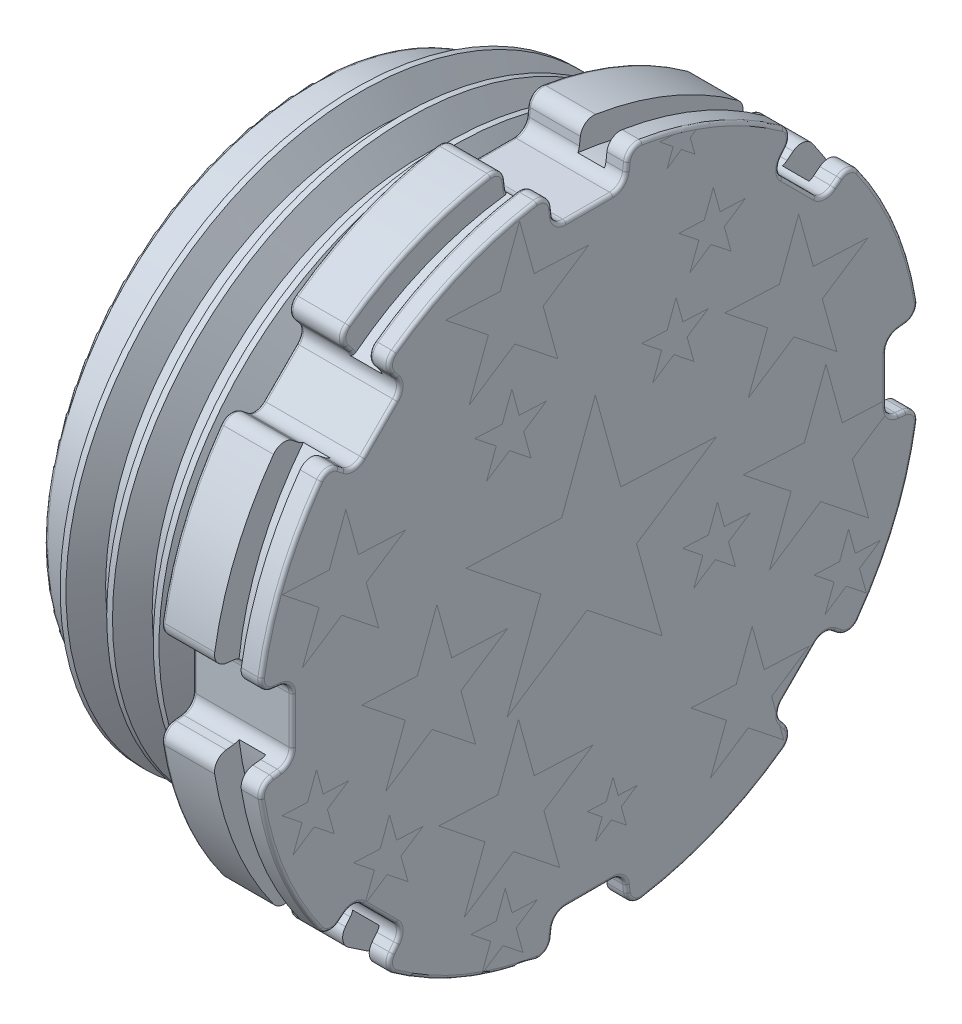
from build123d import *

# Parameters (mm, degrees)
CUT_EXTRUDE1_DEPTH       = 10
FILLET1_R                = 0.2
CIRPATTERN1_COUNT        = 8
FILLET1_OF_CIRPATTERN1_R = 0.2
FILLET2_R                = 0.05
SKETCH3_R                = 3.299808774
CUT_EXTRUDE2_DEPTH       = 3.9
FILLET3_R                = 0.05
THREAD1_PITCH            = 0.7


with BuildPart() as part:
    # Sketch1 → Revolve1 (revolve)
    with BuildSketch(Plane(origin=(0, 0, 0), x_dir=(1, 0, 0), z_dir=(0, 1, 0))):
        Polygon((0, 4), (2.7, 4), (2.7, 5), (3.5, 5), (3.5, 4.6), (3.9, 4.6), (3.9, 5), (4.2, 5), (4.2, 0), (0, 0), align=None)
    revolve(axis=Axis((4.2, 0, 0), (-1, 0, 0)))

    # Sketch2 → Cut-Extrude1 (cut)
    with BuildSketch(Plane(origin=(4.2, 0, 0), x_dir=(0, 0, -1), z_dir=(1, 0, 0))):
        with BuildLine():
            Line((-0.587686987, 4.965342285), (-0.549807555, 4.645300577))
            ThreePointArc((-0.549807555, 4.645300577), (-0.484044351, 4.519306391), (-0.351193864, 4.468808056))
            Line((-0.351193864, 4.468808056), (0.351193864, 4.468808056))
            ThreePointArc((0.351193864, 4.468808056), (0.484044351, 4.519306391), (0.549807555, 4.645300577))
            Line((0.549807555, 4.645300577), (0.587686987, 4.965342285))
            Line((0.587686987, 4.965342285), (1.311604188, 5.951762014))
            Line((1.311604188, 5.951762014), (-0.361272215, 5.978082862))
            Line((-0.361272215, 5.978082862), (-0.587686987, 4.965342285))
        make_face()
    cut_extrude1 = extrude(amount=-CUT_EXTRUDE1_DEPTH, mode=Mode.SUBTRACT)

    # Fillet1
    fillet1_edges = [part.edges().sort_by_distance(p)[0] for p in [
        (3.1, 4.965342285, -0.587686987),
        (4.05, 4.965342285, -0.587686987),
        (3.1, 4.965342285, 0.587686987),
        (4.05, 4.965342285, 0.587686987),
    ]]
    fillet(fillet1_edges, radius=FILLET1_R)

    # CirPattern1: Cut-Extrude1 ×8 about axis
    cirpattern1_axis = Axis((0, 0, 0), (1, 0, 0))
    for i in range(1, CIRPATTERN1_COUNT):
        add(cut_extrude1.rotate(cirpattern1_axis, i * 360 / CIRPATTERN1_COUNT), mode=Mode.SUBTRACT)

    # Fillet1 of CirPattern1
    fillet1_of_cirpattern1_edges = [part.edges().sort_by_distance(p)[0] for p in [
        (3.1, 3.926584654, 3.095469747),
        (4.05, 3.926584654, 3.095469747),
        (3.1, 3.095469747, 3.926584654),
        (4.05, 3.095469747, 3.926584654),
        (3.1, 0.587686987, 4.965342285),
        (4.05, 0.587686987, 4.965342285),
        (3.1, -0.587686987, 4.965342285),
        (4.05, -0.587686987, 4.965342285),
        (3.1, -3.095469747, 3.926584654),
        (4.05, -3.095469747, 3.926584654),
        (3.1, -3.926584654, 3.095469747),
        (4.05, -3.926584654, 3.095469747),
        (3.1, -4.965342285, 0.587686987),
        (4.05, -4.965342285, 0.587686987),
        (3.1, -4.965342285, -0.587686987),
        (4.05, -4.965342285, -0.587686987),
        (3.1, -3.926584654, -3.095469747),
        (4.05, -3.926584654, -3.095469747),
        (3.1, -3.095469747, -3.926584654),
        (4.05, -3.095469747, -3.926584654),
        (3.1, -0.587686987, -4.965342285),
        (4.05, -0.587686987, -4.965342285),
        (3.1, 0.587686987, -4.965342285),
        (4.05, 0.587686987, -4.965342285),
        (3.1, 3.095469747, -3.926584654),
        (4.05, 3.095469747, -3.926584654),
        (3.1, 3.926584654, -3.095469747),
        (4.05, 3.926584654, -3.095469747),
    ]]
    fillet(fillet1_of_cirpattern1_edges, radius=FILLET1_OF_CIRPATTERN1_R)

    # Fillet2
    fillet2_edges = [part.edges().sort_by_distance(p)[0] for p in [
        (3.9, 3.639888494, 2.874515091),
        (2.7, 4.703944794, 0.556748555),
        (2.7, 4.703944794, -0.556748555),
        (2.7, 3.917707542, -3.010087612),
        (2.7, 3.010087612, -3.917707542),
        (2.7, 0.556748555, -4.703944794),
        (2.7, 0.484044351, -4.519306391),
        (2.7, -1.913417162, -4.619397663),
        (2.7, -3.010087612, -3.917707542),
        (2.7, -3.537903238, -2.853361152),
        (2.7, -4.519306391, -0.484044351),
        (2.7, -4.619397663, 1.913417162),
        (2.7, -3.537903238, 2.853361152),
        (2.7, -3.15992448, 3.15992448),
        (2.7, -2.932510583, 3.719871941),
        (2.7, -0.556748555, 4.703944794),
        (2.7, 0.484044351, 4.519306391),
        (2.7, 0.556748555, 4.703944794),
        (2.7, 3.010087612, 3.917707542),
        (2.7, 2.853361152, 3.537903238),
        (3.5, 4.898690932, 0.641784207),
        (3.5, 3.719871941, 2.932510583),
        (4.2, 2.932510583, -3.719871941),
        (4.2, 3.010087612, -3.917707542),
        (4.2, 0.641784207, -4.898690932),
        (4.2, 0.556748555, -4.703944794),
        (4.2, -3.010087612, -3.917707542),
        (4.2, -2.853361152, -3.537903238),
        (4.2, -3.719871941, -2.932510583),
        (4.2, -4.619397663, -1.913417162),
        (4.2, -4.703944794, 0.556748555),
        (4.2, -3.719871941, 2.932510583),
        (4.2, -3.537903238, 2.853361152),
        (4.2, -0.641784207, 4.898690932),
        (4.2, -0.484044351, 4.519306391),
        (4.2, 0.641784207, 4.898690932),
        (4.2, 1.913417162, 4.619397663),
        (4.2, 3.010087612, 3.917707542),
        (4.2, 2.853361152, 3.537903238),
        (4.2, 3.15992448, 3.15992448),
        (4.2, 3.719871941, 2.932510583),
        (4.2, 3.917707542, 3.010087612),
        (4.2, 4.619397663, 1.913417162),
        (4.2, 4.519306391, 0.484044351),
        (4.2, 4.468808056, 0),
        (4.2, 3.917707542, -3.010087612),
        (3.5, 4.619397663, 1.913417162),
    ]]
    fillet(fillet2_edges, radius=FILLET2_R)

    # Sketch3 → Cut-Extrude2 (cut)
    with BuildSketch(Plane.ZY):
        Circle(SKETCH3_R)
    extrude(amount=-CUT_EXTRUDE2_DEPTH, mode=Mode.SUBTRACT)

    # Fillet3
    fillet3_edges = [part.edges().sort_by_distance(p)[0] for p in [
        (0, 0, -3.299808774),
        (0, 0, 4),
    ]]
    fillet(fillet3_edges, radius=FILLET3_R)

    # Thread1: the profile of Thread Profile1 profile screwed along a left-hand helix of 3.785714 turns, 6 arcs to a turn; built about Z, then put on its axis
    thread1_z = Axis((0, 0, 0), (0, 0, 1))
    thread1_corners = [(3.9997, 0, -0.000173205), (4.378886112, 0, 0.218749999), (4.378886112, 0, 0.306249999), (3.9997, 0, 0.525173203)]
    with BuildLine(mode=Mode.PRIVATE) as thread1_profile:
        Line(thread1_corners[0], thread1_corners[1])
        Line(thread1_corners[1], thread1_corners[2])
        Line(thread1_corners[2], thread1_corners[3])
        Line(thread1_corners[3], thread1_corners[0])
    thread1_cap = Face(thread1_profile.wire())
    thread1_turn_angles = [0, -30, -60, -90, -120, -150, -180, -210, -240, -270, -300, -330, -360]
    thread1_turn_weights = [1, 0.8660254037844387, 1, 0.8660254037844387, 1, 0.8660254037844387, 1, 0.8660254037844387, 1, 0.8660254037844387, 1, 0.8660254037844387, 1]
    thread1_turn_rails = [Edge.make_bspline([Vector(p[0], p[1], 0).rotate(thread1_z, thread1_turn_angles[k]) / thread1_turn_weights[k] + Vector(0, 0, p[2] + -THREAD1_PITCH * thread1_turn_angles[k] / 360) for k in range(13)], [0, 0, 0, 1, 1, 2, 2, 3, 3, 4, 4, 5, 5, 6, 6, 6], 2, thread1_turn_weights) for p in thread1_corners]
    thread1_turn_sides = [Face.make_surface_from_curves(thread1_turn_rails[p[0]], thread1_turn_rails[p[1]]) for p in [(0, 1), (1, 2), (2, 3), (3, 0)]]
    thread1_last_angles = [-1080, -1110, -1140, -1170, -1200, -1230, -1260, -1290, -1320, -1341.428571429, -1362.857142857]
    thread1_last_weights = [1, 0.8660254037844387, 1, 0.8660254037844387, 1, 0.8660254037844387, 1, 0.8660254037844387, 1, 0.9308737486442035, 1]
    thread1_last_rails = [Edge.make_bspline([Vector(p[0], p[1], 0).rotate(thread1_z, thread1_last_angles[k]) / thread1_last_weights[k] + Vector(0, 0, p[2] + -THREAD1_PITCH * thread1_last_angles[k] / 360) for k in range(11)], [0, 0, 0, 1, 1, 2, 2, 3, 3, 4, 4, 5, 5, 5], 2, thread1_last_weights) for p in thread1_corners]
    thread1_last_sides = [Face.make_surface_from_curves(thread1_last_rails[p[0]], thread1_last_rails[p[1]]) for p in [(0, 1), (1, 2), (2, 3), (3, 0)]]
    thread1 = Plane(origin=(0.05, 0, 0), x_dir=(0, 0, -1), z_dir=(1, 0, 0)) * Solid(Shell([*[p.moved(Location((0, 0, THREAD1_PITCH * i))) for i in range(3) for p in thread1_turn_sides], *thread1_last_sides, thread1_cap, thread1_cap.rotate(thread1_z, -1362.857142857).moved(Location((0, 0, -THREAD1_PITCH * -1362.857142857 / 360)))]))
    add(thread1)


solid = part.part
